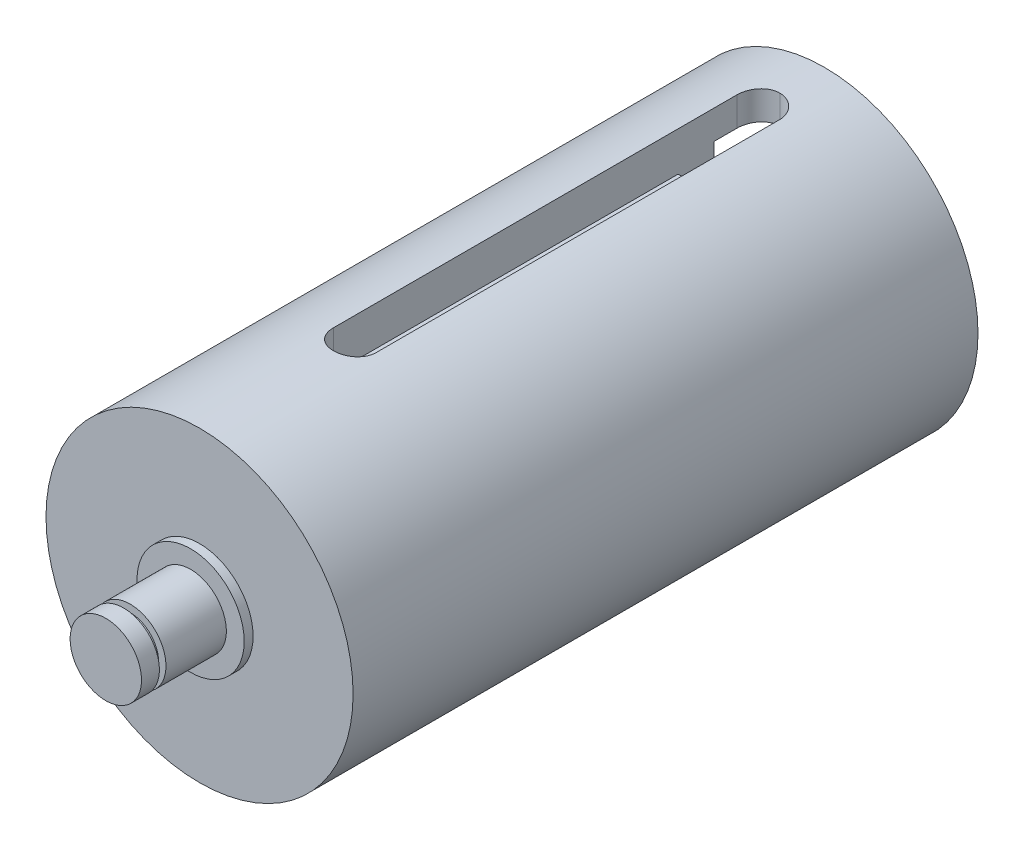
from build123d import *

# Parameters (mm, degrees)
SKETCH1_R           = 17.2
BOSS_EXTRUDE1_DEPTH = 70
SKETCH2_R           = 14
CUT_EXTRUDE1_DEPTH  = 14
SKETCH3_R           = 8.25
CUT_EXTRUDE2_DEPTH  = 50
SKETCH5_R           = 4
BOSS_EXTRUDE2_DEPTH = 10.5
SKETCH9_R           = 16.379462193
BOSS_EXTRUDE4_DEPTH = 4
CUT_EXTRUDE3_START  = -5
CUT_EXTRUDE3_DEPTH  = 50
FILLET2_R           = 2.4
SKETCH7_R           = 6
BOSS_EXTRUDE3_DEPTH = 1
CUT_EXTRUDE4_START  = -2
SKETCH8_R           = 4.26334812
SKETCH8_R_2         = 3.175
CUT_EXTRUDE4_DEPTH  = 0.74
SKETCH10_W          = 4.8
SKETCH10_H          = 4
CUT_EXTRUDE5_DEPTH  = 10


with BuildPart() as part:
    # Sketch1 → Boss-Extrude1 (new body)
    with BuildSketch(Plane.XY):
        Circle(SKETCH1_R)
    extrude(amount=BOSS_EXTRUDE1_DEPTH)

    # Sketch2 → Cut-Extrude1 (cut)
    with BuildSketch(Plane(origin=(0, 0, 0), x_dir=(-1, 0, 0), z_dir=(0, 0, -1))):
        Circle(SKETCH2_R)
    extrude(amount=-CUT_EXTRUDE1_DEPTH, mode=Mode.SUBTRACT)

    # Sketch3 → Cut-Extrude2 (cut)
    with BuildSketch(Plane(origin=(0, 0, 14), x_dir=(-1, 0, 0), z_dir=(0, 0, -1))):
        Circle(SKETCH3_R)
    extrude(amount=-CUT_EXTRUDE2_DEPTH, mode=Mode.SUBTRACT)

    # Sketch4 → Cut-Revolve1 (revolve, cut)
    with BuildSketch(Plane(origin=(0, 0, 0), x_dir=(1, 0, 0), z_dir=(0, 1, 0)), mode=Mode.PRIVATE) as cut_revolve1_sk:
        Polygon((8.25, -64), (0, -66), (0, -64), align=None)
    revolve(cut_revolve1_sk.sketch.rotate(Axis((0, 0, 66), (0, 0, -1)), 180), axis=Axis((0, 0, 66), (0, 0, -1)), mode=Mode.SUBTRACT)

    # Sketch5 → Boss-Extrude2 (add)
    with BuildSketch(Plane.XY.offset(70)):
        with Locations(Location((0, 0, 0), (0, 0, 180))):
            Circle(SKETCH5_R)
    extrude(amount=BOSS_EXTRUDE2_DEPTH)

    # Sketch9 → Boss-Extrude4 (add)
    with BuildSketch(Plane(origin=(0, 0, 14), x_dir=(-1, 0, 0), z_dir=(0, 0, -1))):
        Circle(SKETCH9_R)
        Polygon((-14, 0), (-7, -12.124355653), (7, -12.124355653), (14, 0), (7, 12.124355653), (-7, 12.124355653), align=None, mode=Mode.SUBTRACT)
    extrude(amount=BOSS_EXTRUDE4_DEPTH)

    # Sketch6 → Cut-Extrude3 (cut)
    with BuildSketch(Plane(origin=(0, 0, 0), x_dir=(-1, 0, 0), z_dir=(0, 0, -1)).offset(CUT_EXTRUDE3_START)):
        with BuildLine():
            Line((-2.4, 17.031735085), (-2.4, 12.631735085))
            Line((-2.4, 12.631735085), (2.4, 12.631735085))
            Line((2.4, 12.631735085), (2.4, 17.031735085))
            ThreePointArc((2.4, 17.031735085), (0, 17.2), (-2.4, 17.031735085))
        make_face()
    extrude(amount=-CUT_EXTRUDE3_DEPTH, mode=Mode.SUBTRACT)

    # Fillet2
    fillet2_edges = [part.edges().sort_by_distance(p)[0] for p in [
        (-2.4, 14.831735085, 55),
        (2.4, 14.831735085, 55),
        (-2.4, 15.412243402, 5),
        (2.4, 15.412243402, 5),
    ]]
    fillet(fillet2_edges, radius=FILLET2_R - 0.0001)  # a hair under: the kernel refuses the full size

    # Sketch7 → Boss-Extrude3 (add)
    with BuildSketch(Plane.XY.offset(70)):
        Circle(SKETCH7_R)
    extrude(amount=BOSS_EXTRUDE3_DEPTH)

    # Sketch8 → Cut-Extrude4 (cut)
    with BuildSketch(Plane.XY.offset(80.5).offset(CUT_EXTRUDE4_START)):
        Circle(SKETCH8_R)
        Circle(SKETCH8_R_2, mode=Mode.SUBTRACT)
    extrude(amount=-CUT_EXTRUDE4_DEPTH, mode=Mode.SUBTRACT)

    # Sketch10 → Cut-Extrude5 (cut)
    with BuildSketch(Plane.XZ.offset(-12.124355653)):
        with Locations((0, 12)):
            Rectangle(SKETCH10_W, SKETCH10_H)
    extrude(amount=-CUT_EXTRUDE5_DEPTH, mode=Mode.SUBTRACT)


solid = part.part
